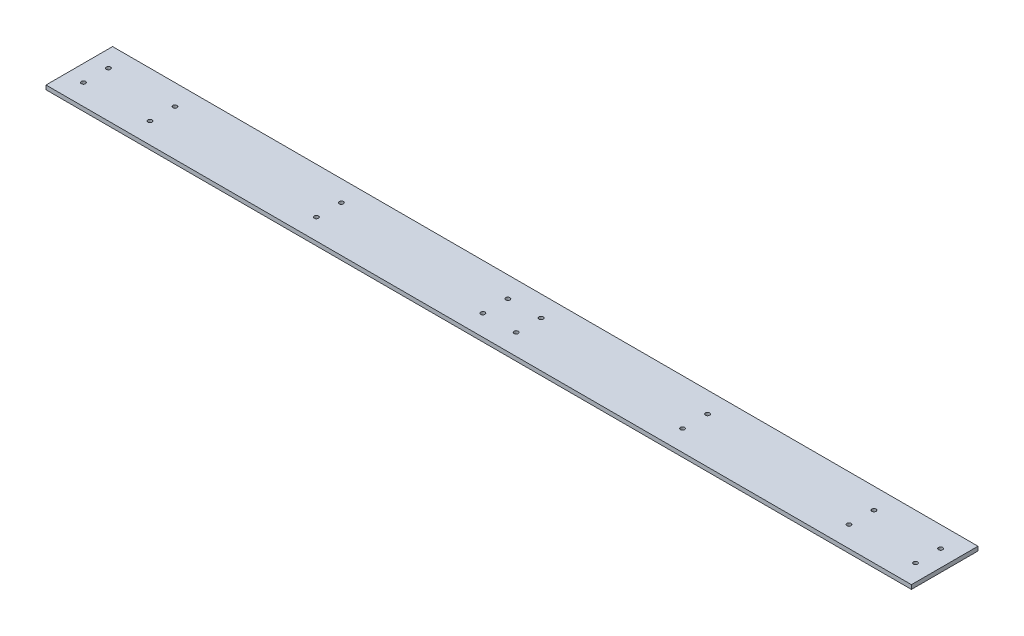
from build123d import *

# Parameters (mm, degrees)
SKETCH1_W           = 1040
SKETCH1_H           = 80
SKETCH1_R           = 2.5
BOSS_EXTRUDE2_DEPTH = 5


with BuildPart() as part:
    # Sketch1 → Boss-Extrude2 (new body)
    with BuildSketch(Plane(origin=(0, 0, 0), x_dir=(1, 0, 0), z_dir=(0, 1, 0))):
        with Locations((20, 0)):
            Rectangle(SKETCH1_W, SKETCH1_H)
        with Locations((0, 15)):
            Circle(SKETCH1_R, mode=Mode.SUBTRACT)
        with Locations((0, -15)):
            Circle(SKETCH1_R, mode=Mode.SUBTRACT)
        with Locations((40, 15)):
            Circle(SKETCH1_R, mode=Mode.SUBTRACT)
        with Locations((40, -15)):
            Circle(SKETCH1_R, mode=Mode.SUBTRACT)
        with Locations((-200, 15)):
            Circle(SKETCH1_R, mode=Mode.SUBTRACT)
        with Locations((-200, -15)):
            Circle(SKETCH1_R, mode=Mode.SUBTRACT)
        with Locations((240, -15)):
            Circle(SKETCH1_R, mode=Mode.SUBTRACT)
        with Locations((240, 15)):
            Circle(SKETCH1_R, mode=Mode.SUBTRACT)
        with Locations((-400, 15)):
            Circle(SKETCH1_R, mode=Mode.SUBTRACT)
        with Locations((-400, -15)):
            Circle(SKETCH1_R, mode=Mode.SUBTRACT)
        with Locations((440, -15)):
            Circle(SKETCH1_R, mode=Mode.SUBTRACT)
        with Locations((440, 15)):
            Circle(SKETCH1_R, mode=Mode.SUBTRACT)
        with Locations((520, 15)):
            Circle(SKETCH1_R, mode=Mode.SUBTRACT)
        with Locations((520, -15)):
            Circle(SKETCH1_R, mode=Mode.SUBTRACT)
        with Locations((-480, 15)):
            Circle(SKETCH1_R, mode=Mode.SUBTRACT)
        with Locations((-480, -15)):
            Circle(SKETCH1_R, mode=Mode.SUBTRACT)
    extrude(amount=BOSS_EXTRUDE2_DEPTH)


solid = part.part
